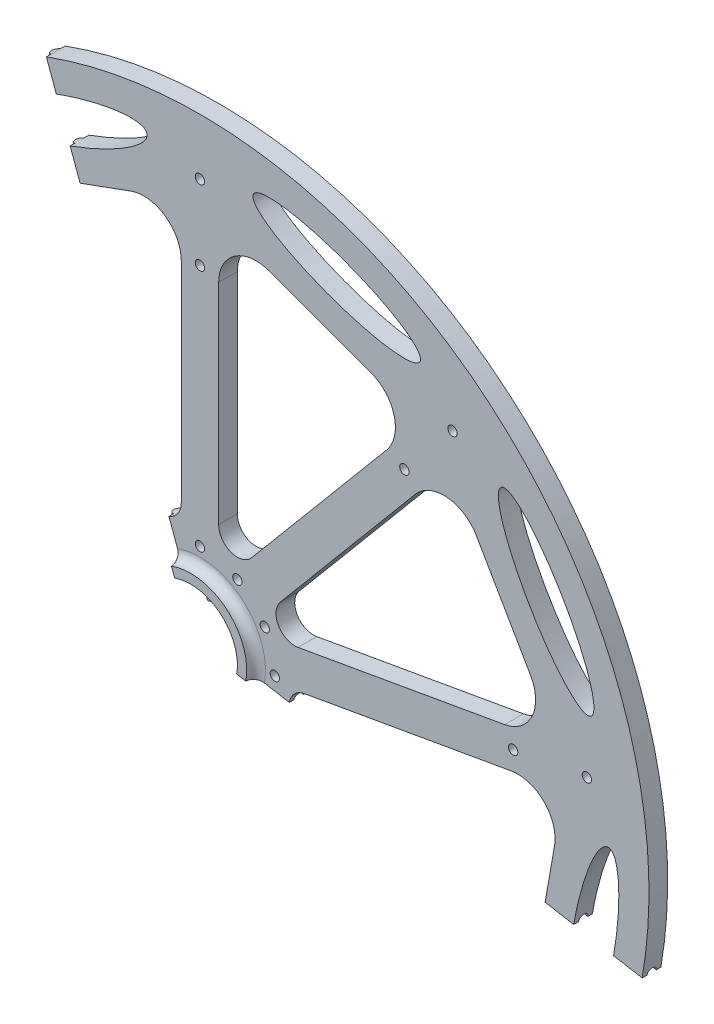
from build123d import *

# Parameters (mm, degrees)
SKETCH1_R           = 1.5875
BOSS_EXTRUDE1_DEPTH = 6.35
BOSS_EXTRUDE2_DEPTH = 133.35
CUT_EXTRUDE1_DEPTH  = 133.35
SKETCH5_RX          = 30.163516005
SKETCH5_RY          = 6.87067886
CUT_EXTRUDE2_DEPTH  = 216.619671093
BOSS_EXTRUDE3_DEPTH = 3.175
CUT_EXTRUDE3_START  = -7.9375
CUT_EXTRUDE3_DEPTH  = 7.9375
FILLET1_R           = 3.175


with BuildPart() as part:
    # Sketch1 → Boss-Extrude1 (new body)
    with BuildSketch(Plane.XY):
        with BuildLine():
            Line((150.084701559, -26.463982276), (6.230674922, -1.098636097))
            ThreePointArc((6.230674922, -1.098636097), (4.06678423, 4.846604717), (-2.163890692, 5.945240813))
            Line((-2.163890692, 5.945240813), (-52.123869843, 143.209155408))
            ThreePointArc((-52.123869843, 143.209155408), (97.960831716, 116.745173131), (150.084701559, -26.463982276))
        make_face()
        with Locations((0, 133.35)):
            Circle(SKETCH1_R, mode=Mode.SUBTRACT)
        with Locations((0, 107.95)):
            Circle(SKETCH1_R, mode=Mode.SUBTRACT)
        with Locations((85.715727752, 102.15202649)):
            Circle(SKETCH1_R, mode=Mode.SUBTRACT)
        with Locations((69.388922466, 82.694497635)):
            Circle(SKETCH1_R, mode=Mode.SUBTRACT)
        with Locations((131.324113864, 23.155984492)):
            Circle(SKETCH1_R, mode=Mode.SUBTRACT)
        with Locations((106.309996938, 18.745320779)):
            Circle(SKETCH1_R, mode=Mode.SUBTRACT)
        with Locations((0, 25.4)):
            Circle(SKETCH1_R, mode=Mode.SUBTRACT)
        with Locations((12.7, 21.997045256)):
            Circle(SKETCH1_R, mode=Mode.SUBTRACT)
        with Locations((21.997045256, 12.7)):
            Circle(SKETCH1_R, mode=Mode.SUBTRACT)
        with Locations((25.4, 0)):
            Circle(SKETCH1_R, mode=Mode.SUBTRACT)
    extrude(amount=BOSS_EXTRUDE1_DEPTH)

    # Sketch2 → Boss-Extrude2 (add)
    with BuildSketch(Plane(origin=(-52.123869843, 143.209155408, 0), x_dir=(0, 0, -1), z_dir=(-0.342020143325673, 0.939692620785907, 0))):
        with BuildLine():
            ThreePointArc((-4.7625, 0), (-3.175, 1.5875), (-1.5875, 0))
            Line((-1.5875, 0), (-4.7625, 0))
        make_face()
    extrude(amount=-BOSS_EXTRUDE2_DEPTH)

    # Sketch3 → Cut-Extrude1 (cut)
    with BuildSketch(Plane(origin=(150.084701559, -26.463982276, 0), x_dir=(0, 0, -1), z_dir=(-0.9848077530122086, 0.1736481776669274, 0))):
        with BuildLine():
            Line((-4.7625, 0), (-1.5875, 0))
            ThreePointArc((-1.5875, 0), (-3.175, -1.5875), (-4.7625, 0))
        make_face()
    extrude(amount=CUT_EXTRUDE1_DEPTH, mode=Mode.SUBTRACT)

    # Sketch5 → Cut-Extrude2 (cut, through all)
    with BuildSketch(Plane.XY.offset(6.35)):
        with Locations(Location((46.404952904, 127.496560255), (0, 0, 160))):
            Ellipse(SKETCH5_RX, SKETCH5_RY)
        with Locations(Location((117.501465515, 67.839502745), (0, 0, -60))):
            Ellipse(SKETCH5_RX, SKETCH5_RY)
        with Locations(Location((133.617736528, -23.560412051), (0, 0, -100))):
            Ellipse(SKETCH5_RX, SKETCH5_RY)
        with Locations(Location((87.212783624, -103.936148204), (0, 0, -140))):
            Ellipse(SKETCH5_RX, SKETCH5_RY)
        with Locations(Location((0, -135.679005491), (0, 0, 180))):
            Ellipse(SKETCH5_RX, SKETCH5_RY)
        with Locations(Location((-87.212783624, -103.936148204), (0, 0, 140))):
            Ellipse(SKETCH5_RX, SKETCH5_RY)
        with Locations(Location((-133.617736528, -23.560412051), (0, 0, 100))):
            Ellipse(SKETCH5_RX, SKETCH5_RY)
        with Locations(Location((-117.501465515, 67.839502746), (0, 0, 60))):
            Ellipse(SKETCH5_RX, SKETCH5_RY)
        with Locations(Location((-46.404952904, 127.496560255), (0, 0, 20))):
            Ellipse(SKETCH5_RX, SKETCH5_RY)
        with BuildLine():
            Line((57.978416111, 105.49005345), (23.39365582, 118.077876756))
            ThreePointArc((23.39365582, 118.077876756), (11.765579258, 116.547011434), (6.35, 106.143780472))
            Line((6.35, 106.143780472), (6.35, 34.892963227))
            ThreePointArc((6.35, 34.892963227), (10.52817209, 28.925915085), (17.564382214, 30.811261906))
            Line((17.564382214, 30.811261906), (63.363524719, 85.392554523))
            ThreePointArc((63.363524719, 85.392554523), (65.902018285, 96.842959039), (57.978416111, 105.49005345))
        make_face()
        with BuildLine():
            Line((112.221742786, 43.542261744), (93.819576202, 75.415749237))
            ThreePointArc((93.819576202, 75.415749237), (83.927931507, 81.717421903), (73.092289146, 77.22915188))
            Line((73.092289146, 77.22915188), (27.293146641, 22.647859263))
            ThreePointArc((27.293146641, 22.647859263), (26.658267541, 15.391157941), (33.260194783, 12.312628709))
            Line((33.260194783, 12.312628709), (103.428552014, 24.685203281))
            ThreePointArc((103.428552014, 24.685203281), (112.733329053, 31.82500982), (112.221742786, 43.542261744))
        make_face()
        with BuildLine():
            Line((113.955268805, -38.77943815), (120.34627419, -2.534245502))
            ThreePointArc((120.34627419, -2.534245502), (116.819471848, 8.651342476), (105.633883871, 12.178144818))
            Line((105.633883871, 12.178144818), (35.46552664, -0.194429754))
            ThreePointArc((35.46552664, -0.194429754), (30.314663336, -5.345293057), (33.393192568, -11.9472203))
            Line((33.393192568, -11.9472203), (95.098210342, -47.572628922))
            ThreePointArc((95.098210342, -47.572628922), (106.815462266, -48.084215189), (113.955268805, -38.77943815))
        make_face()
        with BuildLine():
            Line((62.367858079, -102.955807949), (90.561612985, -79.298438606))
            ThreePointArc((90.561612985, -79.298438606), (95.049883008, -68.462796245), (88.748210342, -58.57115155))
            Line((88.748210342, -58.57115155), (27.043192568, -22.945742928))
            ThreePointArc((27.043192568, -22.945742928), (19.786491246, -23.580622028), (17.901144426, -30.616832152))
            Line((17.901144426, -30.616832152), (42.270359152, -97.570699341))
            ThreePointArc((42.270359152, -97.570699341), (50.917453563, -105.494301515), (62.367858079, -102.955807949))
        make_face()
        with BuildLine():
            Line((-18.402166584, -118.958010982), (18.402166584, -118.958010982))
            ThreePointArc((18.402166584, -118.958010982), (28.805397546, -113.542431724), (30.336262868, -101.914355162))
            Line((30.336262868, -101.914355162), (5.967048142, -34.960487972))
            ThreePointArc((5.967048142, -34.960487972), (0, -30.782315882), (-5.967048142, -34.960487972))
            Line((-5.967048142, -34.960487972), (-30.336262868, -101.914355162))
            ThreePointArc((-30.336262868, -101.914355162), (-28.805397547, -113.542431723), (-18.402166584, -118.958010982))
        make_face()
        with BuildLine():
            Line((-90.561612985, -79.298438605), (-62.367858079, -102.955807949))
            ThreePointArc((-62.367858079, -102.955807949), (-50.917453563, -105.494301515), (-42.270359152, -97.570699341))
            Line((-42.270359152, -97.570699341), (-17.901144426, -30.616832152))
            ThreePointArc((-17.901144426, -30.616832152), (-19.786491246, -23.580622028), (-27.043192568, -22.945742928))
            Line((-27.043192568, -22.945742928), (-88.748210342, -58.57115155))
            ThreePointArc((-88.748210342, -58.57115155), (-95.049883008, -68.462796245), (-90.561612985, -79.298438605))
        make_face()
        with BuildLine():
            Line((-120.34627419, -2.534245501), (-113.955268805, -38.77943815))
            ThreePointArc((-113.955268805, -38.77943815), (-106.815462266, -48.084215189), (-95.098210342, -47.572628922))
            Line((-95.098210342, -47.572628922), (-33.393192568, -11.947220299))
            ThreePointArc((-33.393192568, -11.947220299), (-30.314663336, -5.345293057), (-35.46552664, -0.194429754))
            Line((-35.46552664, -0.194429754), (-105.633883871, 12.178144818))
            ThreePointArc((-105.633883871, 12.178144818), (-116.819471848, 8.651342476), (-120.34627419, -2.534245501))
        make_face()
        with BuildLine():
            Line((-93.819576202, 75.415749238), (-112.221742786, 43.542261745))
            ThreePointArc((-112.221742786, 43.542261745), (-112.733329053, 31.825009821), (-103.428552014, 24.685203281))
            Line((-103.428552014, 24.685203281), (-33.260194783, 12.312628709))
            ThreePointArc((-33.260194783, 12.312628709), (-26.658267541, 15.391157941), (-27.293146641, 22.647859263))
            Line((-27.293146641, 22.647859263), (-73.092289146, 77.229151881))
            ThreePointArc((-73.092289146, 77.229151881), (-83.927931506, 81.717421903), (-93.819576202, 75.415749238))
        make_face()
        with BuildLine():
            Line((-23.39365582, 118.077876756), (-57.978416111, 105.490053451))
            ThreePointArc((-57.978416111, 105.490053451), (-65.902018285, 96.842959039), (-63.363524718, 85.392554524))
            Line((-63.363524718, 85.392554524), (-17.564382214, 30.811261906))
            ThreePointArc((-17.564382214, 30.811261906), (-10.52817209, 28.925915085), (-6.35, 34.892963227))
            Line((-6.35, 34.892963227), (-6.35, 106.143780472))
            ThreePointArc((-6.35, 106.143780472), (-11.765579258, 116.547011434), (-23.39365582, 118.077876756))
        make_face()
    extrude(amount=-CUT_EXTRUDE2_DEPTH, mode=Mode.SUBTRACT)

    # Sketch6 → Boss-Extrude3 (add)
    with BuildSketch(Plane.XY.offset(6.35)):
        with BuildLine():
            Line((6.230674922, -1.098636097), (18.760587695, -3.307997785))
            ThreePointArc((18.760587695, -3.307997785), (12.245103965, 14.593146641), (-6.51548373, 17.901144426))
            Line((-6.51548373, 17.901144426), (-2.163890692, 5.945240813))
            ThreePointArc((-2.163890692, 5.945240813), (4.06678423, 4.846604717), (6.230674922, -1.098636097))
        make_face()
    extrude(amount=BOSS_EXTRUDE3_DEPTH)

    # Sketch7 → Cut-Extrude3 (cut)
    with BuildSketch(Plane.XY.offset(9.525).offset(CUT_EXTRUDE3_START)):
        with BuildLine():
            Line((6.230674922, -1.098636097), (15.633823079, -2.75666482))
            ThreePointArc((15.633823079, -2.75666482), (10.204253304, 12.160955535), (-5.429569775, 14.917620355))
            Line((-5.429569775, 14.917620355), (-2.163890692, 5.945240813))
            ThreePointArc((-2.163890692, 5.945240813), (4.06678423, 4.846604717), (6.230674922, -1.098636097))
        make_face()
    extrude(amount=CUT_EXTRUDE3_DEPTH, mode=Mode.SUBTRACT)

    # Fillet1
    fillet1_edges = [part.edges().sort_by_distance(p)[0] for p in [
        (12.245103965, 14.593146641, 6.35),
    ]]
    fillet(fillet1_edges, radius=FILLET1_R - 0.0001)  # a hair under: the kernel refuses the full size


solid = part.part
